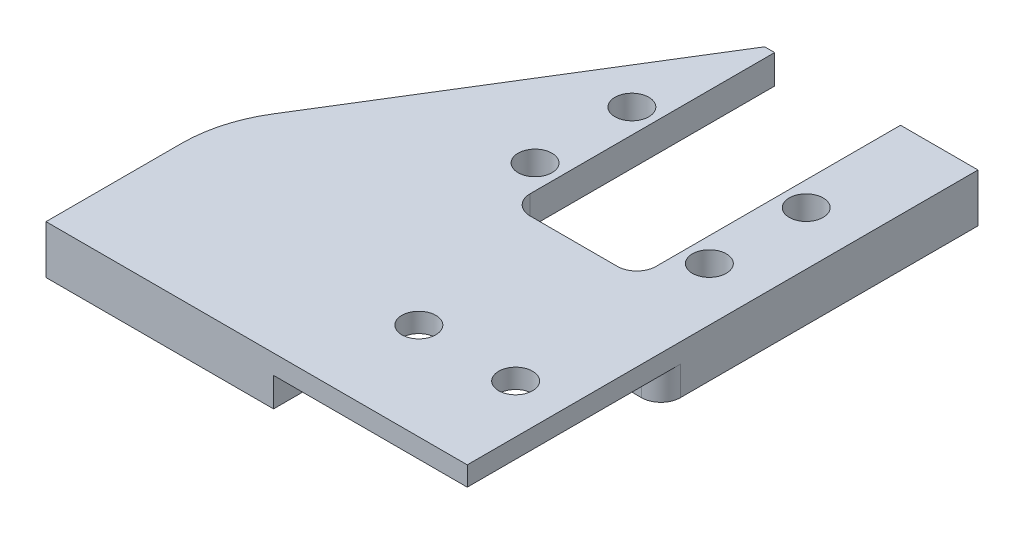
from build123d import *

# Parameters (mm, degrees)
SKETCH_1_W                = 35
SKETCH_1_H                = 55
EXTRUDE_1_DEPTH           = 1
EXTRUDE_2_DEPTH           = 3
SKETCH_3_R                = 5
CUT_EXTRUDE_1_DEPTH       = 169.569903897
SKETCH_4_R                = 4
CUT_EXTRUDE_2_DEPTH       = 2
SKETCH_5_R                = 2
CUT_EXTRUDE_3_DEPTH       = 2
EXTRUDE_START             = 7
EXTRUDE_3_DEPTH           = 7
CUT_EXTRUDE_START         = -1.5
SKETCH_9_W                = 10
SKETCH_9_H                = 26
CUT_EXTRUDE_4_DEPTH       = 168.318874833
SKETCH_10_R               = 1.5
CUT_EXTRUDE_5_DEPTH       = 194.595583627
EXTRUDE_4_DEPTH           = 3
SKETCH_13_W               = 334.012533363
SKETCH_13_H               = 161.456209481
CUT_EXTRUDE_6_DEPTH       = 10
SKETCH_14_R               = 3.5
CUT_EXTRUDE_7_DEPTH       = 2.5
SKETCH_15_R               = 5
CUT_EXTRUDE_8_DEPTH       = 179.854165453
EXTRUDE_START_2           = 16
EXTRUDE_5_DEPTH           = 16
EXTRUDE_6_DEPTH           = 7
SKETCH_19_W               = 10
SKETCH_19_H               = 26
CUT_EXTRUDE_9_DEPTH       = 180.209193181
SKETCH_20_R               = 1.5
CUT_EXTRUDE_10_DEPTH      = 175.844216376
THREAD_1_PITCH            = 0.6
CUT_EXTRUDE_11_DEPTH      = 181.709193232
SKETCH_22_W               = 13
SKETCH_22_H               = 1.5
CUT_EXTRUDE_12_DEPTH      = 7
SKETCH_23_R               = 5
EXTRUDE_7_DEPTH           = 2
CUT_EXTRUDE_START_2       = -3
CUT_EXTRUDE_15_DEPTH      = 177.762490825
SKETCH_25_R               = 7
CUT_EXTRUDE_16_DEPTH      = 4
CUT_EXTRUDE_17_DEPTH      = 10
SKETCH_27_R               = 1.75
CUT_EXTRUDE_18_DEPTH      = 10
CUT_EXTRUDE_19_DEPTH      = 180.762490825
CUT_EXTRUDE_19_DEPTH_BACK = 60
CUT_EXTRUDE_20_DEPTH      = 2
SKETCH_30_W               = 11.653427307
SKETCH_30_H               = 7.287785495
CUT_EXTRUDE_21_DEPTH      = 193.522031886
SKETCH_31_W               = 3.751946438
SKETCH_31_H               = 6.76496914
CUT_EXTRUDE_22_DEPTH      = 10
SKETCH_32_R               = 1
CUT_EXTRUDE_23_DEPTH      = 10
SKETCH_33_R               = 6.599468503
EXTRUDE_8_DEPTH           = 1
SKETCH_35_W               = 76.825944062
SKETCH_35_H               = 20.911958218
CUT_EXTRUDE_24_DEPTH      = 193.102403623
SKETCH_36_W               = 20
SKETCH_36_H               = 20
CUT_EXTRUDE_25_DEPTH      = 3
SKETCH_37_R               = 1.75
CUT_EXTRUDE_26_DEPTH      = 10
FILLET_1_R                = 2


with BuildPart() as part:
    # Sketch 1 → 凸台-拉伸1 (new body)
    with BuildSketch(Plane(origin=(0, 0, 0), x_dir=(1, 0, 0), z_dir=(0, 1, 0))):
        Rectangle(SKETCH_1_W, SKETCH_1_H)
    extrude(amount=EXTRUDE_1_DEPTH)

    # 草图2 → 凸台-拉伸2 (add)
    with BuildSketch(Plane(origin=(0, 1, 0), x_dir=(1, 0, 0), z_dir=(0, 1, 0))):
        with BuildLine():
            Line((106.75, -2.25), (106.75, 2.25))
            Line((106.75, 2.25), (121.75, 2.25))
            ThreePointArc((121.75, 2.25), (122.922125199, 2.352547667), (124.058635967, 2.65707481))
            Line((124.058635967, 2.65707481), (154.058635967, 13.576181838))
            ThreePointArc((154.058635967, 13.576181838), (158.397452333, 21.091232227), (151.75, 26.669107028))
            Line((151.75, 26.669107028), (-31.447415548, 57.101298968))
            ThreePointArc((-31.447415548, 57.101298968), (-37.800418235, 56.264673928), (-42.609265279, 52.029632639))
            Line((-42.609265279, 52.029632639), (-60.161792173, 23.605896086))
            ThreePointArc((-60.161792173, 23.605896086), (-61.717833724, 20.073278016), (-62.25, 16.25))
            Line((-62.25, 16.25), (-62.25, -16.25))
            ThreePointArc((-62.25, -16.25), (-61.717833724, -20.073278016), (-60.161792173, -23.605896086))
            Line((-60.161792173, -23.605896086), (-42.609265279, -52.029632639))
            ThreePointArc((-42.609265279, -52.029632639), (-37.800418235, -56.264673928), (-31.447415548, -57.101298968))
            Line((-31.447415548, -57.101298968), (151.75, -26.669107028))
            ThreePointArc((151.75, -26.669107028), (158.397452333, -21.091232227), (154.058635967, -13.576181838))
            Line((154.058635967, -13.576181838), (124.058635967, -2.65707481))
            ThreePointArc((124.058635967, -2.65707481), (122.922125199, -2.352547667), (121.75, -2.25))
            Line((121.75, -2.25), (106.75, -2.25))
        make_face()
    extrude(amount=EXTRUDE_2_DEPTH)

    # 草图3 → 切除-拉伸1 (cut, through all)
    with BuildSketch(Plane(origin=(0, 4, 0), x_dir=(1, 0, 0), z_dir=(0, 1, 0))):
        with Locations(Location((-48.25, 16.25, 0), (0, 0, 270))):
            Circle(SKETCH_3_R)
        with Locations(Location((-48.25, -16.25, 0), (0, 0, 270))):
            Circle(SKETCH_3_R)
    extrude(amount=-CUT_EXTRUDE_1_DEPTH, mode=Mode.SUBTRACT)

    # 草图4 → 切除-拉伸2 (cut)
    with BuildSketch(Plane(origin=(0, 4, 0), x_dir=(1, 0, 0), z_dir=(0, 1, 0))):
        with Locations(Location((-33.25, 46.25, 0), (0, 0, 270))):
            Circle(SKETCH_4_R)
        with Locations(Location((-33.25, -46.25, 0), (0, 0, 270))):
            Circle(SKETCH_4_R)
    extrude(amount=-CUT_EXTRUDE_2_DEPTH, mode=Mode.SUBTRACT)

    # 草图5 → 切除-拉伸3 (cut)
    with BuildSketch(Plane(origin=(0, 4, 0), x_dir=(1, 0, 0), z_dir=(0, 1, 0))):
        with Locations(Location((121.75, 9, 0), (0, 0, 270))):
            Circle(SKETCH_5_R)
        with Locations(Location((121.75, -9, 0), (0, 0, 270))):
            Circle(SKETCH_5_R)
        with Locations(Location((151.75, 19.919107028, 0), (0, 0, 270))):
            Circle(SKETCH_5_R)
        with Locations(Location((151.75, -19.919107028, 0), (0, 0, 270))):
            Circle(SKETCH_5_R)
    extrude(amount=-CUT_EXTRUDE_3_DEPTH, mode=Mode.SUBTRACT)

    # 草图8 → 凸台-拉伸3 (add)
    with BuildSketch(Plane.XZ.offset(-1).offset(EXTRUDE_START)):
        with BuildLine():
            Line((-26.75, -26.25), (-39.75, -26.25))
            Line((-39.75, -26.25), (-39.75, -55.124119675))
            ThreePointArc((-39.75, -55.124119675), (-35.798281322, -56.950759894), (-31.447415548, -57.101298968))
            Line((-31.447415548, -57.101298968), (-26.75, -56.320978726))
            Line((-26.75, -56.320978726), (-26.75, -26.25))
        make_face()
    extrude_3 = extrude(amount=-EXTRUDE_3_DEPTH)

    # 镜向1: 凸台-拉伸3 across plane
    add(extrude_3.mirror(Plane.XY))

    # 草图9 → 切除-拉伸4 (cut, through all)
    with BuildSketch(Plane.XZ.offset(6).offset(CUT_EXTRUDE_START)):
        with Locations((-33.25, -40.75)):
            Rectangle(SKETCH_9_W, SKETCH_9_H)
    cut_extrude_4 = extrude(amount=-CUT_EXTRUDE_4_DEPTH, mode=Mode.SUBTRACT)

    # 镜向2: 切除-拉伸4 across plane
    add(cut_extrude_4.mirror(Plane.XY), mode=Mode.SUBTRACT)

    # 草图10 → 切除-拉伸5 (cut, through all)
    with BuildSketch(Plane.XY.offset(-53.75)):
        with Locations((-33.25, -1.5)):
            Circle(SKETCH_10_R)
    cut_extrude_5 = extrude(amount=-CUT_EXTRUDE_5_DEPTH, mode=Mode.SUBTRACT)

    # 镜向3: 切除-拉伸5 across plane
    add(cut_extrude_5.mirror(Plane.XY), mode=Mode.SUBTRACT)

    # 草图12 → 凸台-拉伸4 (add)
    with BuildSketch(Plane(origin=(0, 4, 0), x_dir=(1, 0, 0), z_dir=(0, 1, 0))):
        with BuildLine():
            Line((152.536154407, 34.648141662), (-30.136445037, 64.993152763))
            ThreePointArc((-30.136445037, 64.993152763), (-32.296727103, 65.226071005), (-34.469475839, 65.210824842))
            Line((-34.469475839, 65.210824842), (-60.161792173, 23.605896086))
            ThreePointArc((-60.161792173, 23.605896086), (-61.717833724, 20.073278016), (-62.25, 16.25))
            Line((-62.25, 16.25), (-62.25, 2.25))
            Line((-62.25, 2.25), (121.75, 2.25))
            ThreePointArc((121.75, 2.25), (122.922125199, 2.352547667), (124.058635967, 2.65707481))
            Line((124.058635967, 2.65707481), (166.382589153, 18.061733966))
            ThreePointArc((166.382589153, 18.061733966), (163.073058037, 29.371665237), (152.536154407, 34.648141662))
        make_face()
    extrude(amount=EXTRUDE_4_DEPTH)

    # 草图13 → 切除-拉伸6 (cut)
    with BuildSketch(Plane.XZ.offset(-4)):
        with Locations((47.836319436, 6.16656882)):
            Rectangle(SKETCH_13_W, SKETCH_13_H)
    extrude(amount=CUT_EXTRUDE_6_DEPTH, mode=Mode.SUBTRACT)

    # 草图14 → 切除-拉伸7 (cut)
    with BuildSketch(Plane.XZ.offset(-4)):
        with Locations(Location((151.75, -19.919107028, 0), (0, 0, 270))):
            Circle(SKETCH_14_R)
        with Locations(Location((121.75, -9, 0), (0, 0, 270))):
            Circle(SKETCH_14_R)
    extrude(amount=-CUT_EXTRUDE_7_DEPTH, mode=Mode.SUBTRACT)

    # 草图15 → 切除-拉伸8 (cut, through all)
    with BuildSketch(Plane.XZ.offset(-4)):
        with Locations(Location((-48.25, -16.25, 0), (0, 0, 270))):
            Circle(SKETCH_15_R)
    extrude(amount=-CUT_EXTRUDE_8_DEPTH, mode=Mode.SUBTRACT)

    # 草图17 → 凸台-拉伸5 (add)
    with BuildSketch(Plane.XZ.offset(-4).offset(EXTRUDE_START_2)):
        with BuildLine():
            Line((-30.628058978, -62.03370759), (152.218782473, -31.659751942))
            ThreePointArc((152.218782473, -31.659751942), (161.216553887, -26.879484712), (163.096310198, -16.865626245))
            Line((163.096310198, -16.865626245), (166.382589153, -18.061733966))
            ThreePointArc((166.382589153, -18.061733966), (163.073058037, -29.371665237), (152.536154407, -34.648141662))
            Line((152.536154407, -34.648141662), (-30.136445037, -64.993152763))
            ThreePointArc((-30.136445037, -64.993152763), (-32.296727103, -65.226071005), (-34.469475839, -65.210824842))
            Line((-34.469475839, -65.210824842), (-36.504423199, -61.915526791))
            ThreePointArc((-36.504423199, -61.915526791), (-33.571714316, -62.246765295), (-30.628058978, -62.03370759))
        make_face()
    extrude(amount=-EXTRUDE_5_DEPTH)

    # 草图18 → 凸台-拉伸6 (add)
    with BuildSketch(Plane(origin=(0, 7, 0), x_dir=(1, 0, 0), z_dir=(0, 1, 0))):
        with BuildLine():
            Line((-39.75, 56.65979236), (-39.75, 26.25))
            Line((-39.75, 26.25), (-26.75, 26.25))
            Line((-26.75, 26.25), (-26.75, 64.430606916))
            Line((-26.75, 64.430606916), (-30.136445037, 64.993152763))
            ThreePointArc((-30.136445037, 64.993152763), (-32.296727103, 65.226071005), (-34.469475839, 65.210824842))
            Line((-34.469475839, 65.210824842), (-39.75, 56.65979236))
        make_face()
    extrude(amount=EXTRUDE_6_DEPTH)

    # 草图19 → 切除-拉伸9 (cut, through all)
    with BuildSketch(Plane(origin=(0, 14, 0), x_dir=(1, 0, 0), z_dir=(0, 1, 0)).offset(CUT_EXTRUDE_START)):
        with Locations((-33.25, 40.75)):
            Rectangle(SKETCH_19_W, SKETCH_19_H)
    extrude(amount=-CUT_EXTRUDE_9_DEPTH, mode=Mode.SUBTRACT)

    # 草图20 → 切除-拉伸10 (cut, through all)
    with BuildSketch(Plane.XY.offset(-53.75)):
        with Locations((-33.25, 9.5)):
            Circle(SKETCH_20_R)
    extrude(amount=-CUT_EXTRUDE_10_DEPTH, mode=Mode.SUBTRACT)

    # 螺纹线1: the profile of Sketch 1 2 profile screwed along a right-hand helix of 25 turns, 6 arcs to a turn; built about Z, then put on its axis
    thread_1_z = Axis((0, 0, 0), (0, 0, 1))
    thread_1_corners = [(1.4997, 0, -0.000173205), (1.824759525, 0, 0.187499999), (1.824759525, 0, 0.262499999), (1.4997, 0, 0.450173203)]
    with BuildLine(mode=Mode.PRIVATE) as thread_1_profile:
        Line(thread_1_corners[0], thread_1_corners[1])
        Line(thread_1_corners[1], thread_1_corners[2])
        Line(thread_1_corners[2], thread_1_corners[3])
        Line(thread_1_corners[3], thread_1_corners[0])
    thread_1_cap = Face(thread_1_profile.wire())
    thread_1_turn_angles = [0, 30, 60, 90, 120, 150, 180, 210, 240, 270, 300, 330, 360]
    thread_1_turn_weights = [1, 0.8660254037844387, 1, 0.8660254037844387, 1, 0.8660254037844387, 1, 0.8660254037844387, 1, 0.8660254037844387, 1, 0.8660254037844387, 1]
    thread_1_turn_rails = [Edge.make_bspline([Vector(p[0], p[1], 0).rotate(thread_1_z, thread_1_turn_angles[k]) / thread_1_turn_weights[k] + Vector(0, 0, p[2] + THREAD_1_PITCH * thread_1_turn_angles[k] / 360) for k in range(13)], [0, 0, 0, 1, 1, 2, 2, 3, 3, 4, 4, 5, 5, 6, 6, 6], 2, thread_1_turn_weights) for p in thread_1_corners]
    thread_1_turn_sides = [Face.make_surface_from_curves(thread_1_turn_rails[p[0]], thread_1_turn_rails[p[1]]) for p in [(0, 1), (1, 2), (2, 3), (3, 0)]]
    thread_1 = Plane(origin=(-33.25, 9.5, -53.75), x_dir=(-1, 0, 0), z_dir=(0, 0, -1)) * Solid(Shell([*[p.moved(Location((0, 0, THREAD_1_PITCH * i))) for i in range(25) for p in thread_1_turn_sides], thread_1_cap, thread_1_cap.rotate(thread_1_z, 9000).moved(Location((0, 0, THREAD_1_PITCH * 9000 / 360)))]))
    add(thread_1, mode=Mode.SUBTRACT)

    # 草图21 → 切除-拉伸11 (cut, through all)
    with BuildSketch(Plane(origin=(0, 14, 0), x_dir=(1, 0, 0), z_dir=(0, 1, 0))):
        with BuildLine():
            Line((-39.75, 27.75), (-26.75, 27.75))
            Line((-26.75, 27.75), (-26.75, 64.430606916))
            Line((-26.75, 64.430606916), (-30.136445037, 64.993152763))
            ThreePointArc((-30.136445037, 64.993152763), (-32.296727103, 65.226071005), (-34.469475839, 65.210824842))
            Line((-34.469475839, 65.210824842), (-39.75, 56.65979236))
            Line((-39.75, 56.65979236), (-39.75, 27.75))
        make_face()
    extrude(amount=-CUT_EXTRUDE_11_DEPTH, mode=Mode.SUBTRACT)

    # 草图22 → 切除-拉伸12 (cut)
    with BuildSketch(Plane(origin=(0, 14, 0), x_dir=(1, 0, 0), z_dir=(0, 1, 0))):
        with Locations((-33.25, 27)):
            Rectangle(SKETCH_22_W, SKETCH_22_H)
    extrude(amount=-CUT_EXTRUDE_12_DEPTH, mode=Mode.SUBTRACT)

    # 草图23 → 凸台-拉伸7 (add)
    with BuildSketch(Plane(origin=(0, 7, 0), x_dir=(1, 0, 0), z_dir=(0, 1, 0))):
        with BuildLine():
            Line((-26.75, 27.75), (-39.75, 27.75))
            Line((-39.75, 27.75), (-39.75, 56.65979236))
            Line((-39.75, 56.65979236), (-60.161792173, 23.605896086))
            ThreePointArc((-60.161792173, 23.605896086), (-61.717833724, 20.073278016), (-62.25, 16.25))
            Line((-62.25, 16.25), (-62.25, 2.25))
            Line((-62.25, 2.25), (-18.75, 2.25))
            Line((-18.75, 2.25), (-18.75, 63.101671489))
            Line((-18.75, 63.101671489), (-26.75, 64.430606916))
            Line((-26.75, 64.430606916), (-26.75, 27.75))
        make_face()
        with Locations(Location((-48.25, 16.25, 0), (0, 0, 90))):
            Circle(SKETCH_23_R, mode=Mode.SUBTRACT)
    extrude(amount=EXTRUDE_7_DEPTH)

    # 草图24 → 切除-拉伸15 (cut, through all)
    with BuildSketch(Plane(origin=(0, 9, 0), x_dir=(1, 0, 0), z_dir=(0, 1, 0)).offset(CUT_EXTRUDE_START_2)):
        Polygon((-45.75, 46.034880297), (-45.75, 27.75), (-39.75, 27.75), (-39.75, 56.65979236), (-45.75, 46.943674541), align=None)
        Polygon((-26.75, 64.430606916), (-26.75, 27.75), (-20.75, 27.75), (-20.75, 63.433905346), align=None)
    extrude(amount=-CUT_EXTRUDE_15_DEPTH, mode=Mode.SUBTRACT)

    # 草图25 → 切除-拉伸16 (cut)
    with BuildSketch(Plane.XZ.offset(-4)):
        with Locations(Location((-48.25, -16.25, 0), (0, 0, 270))):
            Circle(SKETCH_25_R)
    extrude(amount=-CUT_EXTRUDE_16_DEPTH, mode=Mode.SUBTRACT)

    # 草图26 → 切除-拉伸17 (cut)
    with BuildSketch(Plane(origin=(0, 7, 0), x_dir=(1, 0, 0), z_dir=(0, 1, 0))):
        with BuildLine():
            Line((3.5, 31.25), (3.5, 35.25))
            ThreePointArc((3.5, 35.25), (1.75, 37), (0, 35.25))
            Line((0, 35.25), (0, 31.25))
            ThreePointArc((0, 31.25), (1.75, 29.5), (3.5, 31.25))
        make_face()
        with BuildLine():
            ThreePointArc((41.75, 18), (40.512563133, 17.487436867), (40, 16.25))
            Line((40, 16.25), (47.5, 16.25))
            ThreePointArc((47.5, 16.25), (46.987436867, 17.487436867), (45.75, 18))
            Line((45.75, 18), (41.75, 18))
        make_face()
        with BuildLine():
            Line((47.5, 16.25), (40, 16.25))
            ThreePointArc((40, 16.25), (40.512563133, 15.012563133), (41.75, 14.5))
            Line((41.75, 14.5), (45.75, 14.5))
            ThreePointArc((45.75, 14.5), (46.987436867, 15.012563133), (47.5, 16.25))
        make_face()
        with BuildLine():
            Line((81.75, 14.5), (85.75, 14.5))
            ThreePointArc((85.75, 14.5), (87.5, 16.25), (85.75, 18))
            Line((85.75, 18), (81.75, 18))
            ThreePointArc((81.75, 18), (80, 16.25), (81.75, 14.5))
        make_face()
        with BuildLine():
            Line((1.75, 18), (5.75, 18))
            ThreePointArc((5.75, 18), (7.5, 16.25), (5.75, 14.5))
            Line((5.75, 14.5), (1.75, 14.5))
            ThreePointArc((1.75, 14.5), (0, 16.25), (1.75, 18))
        make_face()
    extrude(amount=-CUT_EXTRUDE_17_DEPTH, mode=Mode.SUBTRACT)

    # 草图27 → 切除-拉伸18 (cut)
    with BuildSketch(Plane.XZ.offset(-6)):
        with Locations(Location((-42.25, -32.75, 0), (0, 0, 270))):
            Circle(SKETCH_27_R)
        with Locations(Location((-42.25, -42.75, 0), (0, 0, 270))):
            Circle(SKETCH_27_R)
        with Locations(Location((-24.25, -32.75, 0), (0, 0, 270))):
            Circle(SKETCH_27_R)
        with Locations(Location((-24.25, -42.75, 0), (0, 0, 270))):
            Circle(SKETCH_27_R)
    extrude(amount=-CUT_EXTRUDE_18_DEPTH, mode=Mode.SUBTRACT)

    # 草图28 → 切除-拉伸19 (cut, two sides: drawn at the far end of the back side and taken through both)
    with BuildSketch(Plane.XZ.offset(12).offset(-CUT_EXTRUDE_19_DEPTH_BACK)):
        with BuildLine():
            Line((152.218782473, -31.659751942), (-20.75, -60.392794775))
            Line((-20.75, -60.392794775), (-20.75, -63.433905346))
            Line((-20.75, -63.433905346), (152.536154407, -34.648141662))
            ThreePointArc((152.536154407, -34.648141662), (163.073058037, -29.371665237), (166.382589153, -18.061733966))
            Line((166.382589153, -18.061733966), (163.096310198, -16.865626245))
            ThreePointArc((163.096310198, -16.865626245), (161.216553887, -26.879484712), (152.218782473, -31.659751942))
        make_face()
        Polygon((-26.75, -61.389496345), (-26.75, -64.430606916), (-20.75, -63.433905346), (-20.75, -60.392794775), align=None)
    extrude(amount=CUT_EXTRUDE_19_DEPTH + CUT_EXTRUDE_19_DEPTH_BACK, mode=Mode.SUBTRACT)

    # 草图29 → 切除-拉伸20 (cut)
    with BuildSketch(Plane.XZ.offset(-4).offset(CUT_EXTRUDE_START_2)):
        with BuildLine():
            Line((-18.75, -60.060560918), (152.218782473, -31.659751942))
            ThreePointArc((152.218782473, -31.659751942), (161.216553887, -26.879484712), (163.096310198, -16.865626245))
            Line((163.096310198, -16.865626245), (154.058635967, -13.576181838))
            ThreePointArc((154.058635967, -13.576181838), (158.397452333, -21.091232227), (151.75, -26.669107028))
            Line((151.75, -26.669107028), (-18.75, -54.9920433))
            Line((-18.75, -54.9920433), (-18.75, -60.060560918))
        make_face()
    extrude(amount=CUT_EXTRUDE_20_DEPTH, mode=Mode.SUBTRACT)

    # 草图30 → 切除-拉伸21 (cut, through all)
    with BuildSketch(Plane(origin=(-18.75, 0, 0), x_dir=(0, 0, -1), z_dir=(1, 0, 0))):
        with Locations((60.818756954, 8.643892748)):
            Rectangle(SKETCH_30_W, SKETCH_30_H)
    extrude(amount=-CUT_EXTRUDE_21_DEPTH, mode=Mode.SUBTRACT)

    # 草图31 → 切除-拉伸22 (cut)
    with BuildSketch(Plane(origin=(0, 5, 0), x_dir=(1, 0, 0), z_dir=(0, 1, 0))):
        with Locations((-20.625973219, 58.37452787)):
            Rectangle(SKETCH_31_W, SKETCH_31_H)
    extrude(amount=-CUT_EXTRUDE_22_DEPTH, mode=Mode.SUBTRACT)

    # 草图32 → 切除-拉伸23 (cut)
    with BuildSketch(Plane(origin=(0, 5, 0), x_dir=(1, 0, 0), z_dir=(0, 1, 0))):
        with BuildLine():
            ThreePointArc((11.886282262, 52.603213934), (10.968496238, 53.599828635), (9.899800538, 52.767085248))
            Line((9.899800538, 52.767085248), (11.872763986, 52.43934262))
            ThreePointArc((11.872763986, 52.43934262), (11.882896963, 52.520999958), (11.886282262, 52.603213934))
        make_face()
        with BuildLine():
            Line((11.872763986, 52.43934262), (9.899800538, 52.767085248))
            ThreePointArc((9.899800538, 52.767085248), (10.722410948, 51.61673221), (11.872763986, 52.43934262))
        make_face()
        with BuildLine():
            ThreePointArc((51.345551236, 46.04836138), (50.427765212, 47.044976081), (49.359069512, 46.212232694))
            Line((49.359069512, 46.212232694), (51.332032961, 45.884490066))
            ThreePointArc((51.332032961, 45.884490066), (51.342165937, 45.966147404), (51.345551236, 46.04836138))
        make_face()
        with BuildLine():
            Line((51.332032961, 45.884490066), (49.359069512, 46.212232694))
            ThreePointArc((49.359069512, 46.212232694), (50.181679923, 45.061879655), (51.332032961, 45.884490066))
        make_face()
        with Locations(Location((89.804820211, 39.493508826, 0), (0, 0, 270))):
            Circle(SKETCH_32_R)
        with Locations(Location((129.264089185, 32.938656271, 0), (0, 0, 270))):
            Circle(SKETCH_32_R)
    extrude(amount=-CUT_EXTRUDE_23_DEPTH, mode=Mode.SUBTRACT)

    # 草图33 → 凸台-拉伸8 (add)
    with BuildSketch(Plane(origin=(0, 9, 0), x_dir=(1, 0, 0), z_dir=(0, 1, 0))):
        with Locations((-48.25, 16.25)):
            Circle(SKETCH_33_R)
    extrude(amount=-EXTRUDE_8_DEPTH)

    # 草图35 → 切除-拉伸24 (cut, through all)
    with BuildSketch(Plane(origin=(-18.75, 0, 0), x_dir=(0, 0, -1), z_dir=(1, 0, 0))):
        with Locations((36.542659939, 3.314485228)):
            Rectangle(SKETCH_35_W, SKETCH_35_H)
    extrude(amount=CUT_EXTRUDE_24_DEPTH, mode=Mode.SUBTRACT)

    # 草图36 → 切除-拉伸25 (cut)
    with BuildSketch(Plane.XZ.offset(-4)):
        with Locations((-28.75, -12.25)):
            Rectangle(SKETCH_36_W, SKETCH_36_H)
    extrude(amount=-CUT_EXTRUDE_25_DEPTH, mode=Mode.SUBTRACT)

    # 草图37 → 切除-拉伸26 (cut)
    with BuildSketch(Plane.XZ.offset(-7)):
        with BuildLine():
            ThreePointArc((-25.5, -12.25), (-23.75, -14), (-22, -12.25))
            Line((-22, -12.25), (-25.5, -12.25))
        make_face()
        with BuildLine():
            Line((-25.5, -12.25), (-22, -12.25))
            ThreePointArc((-22, -12.25), (-23.75, -10.5), (-25.5, -12.25))
        make_face()
        with Locations(Location((-33.75, -12.25, 0), (0, 0, 270))):
            Circle(SKETCH_37_R)
    extrude(amount=-CUT_EXTRUDE_26_DEPTH, mode=Mode.SUBTRACT)

    # 圆角1
    fillet_1_edges = [part.edges().sort_by_distance(p)[0] for p in [
        (-39.75, 7.5, -27.75),
        (-26.75, 7.5, -27.75),
        (-45.75, 5, -27.75),
        (-20.75, 5, -27.75),
        (-18.75, 5.5, -22.25),
        (-38.75, 5.5, -22.25),
    ]]
    fillet(fillet_1_edges, radius=FILLET_1_R)


solid = part.part
